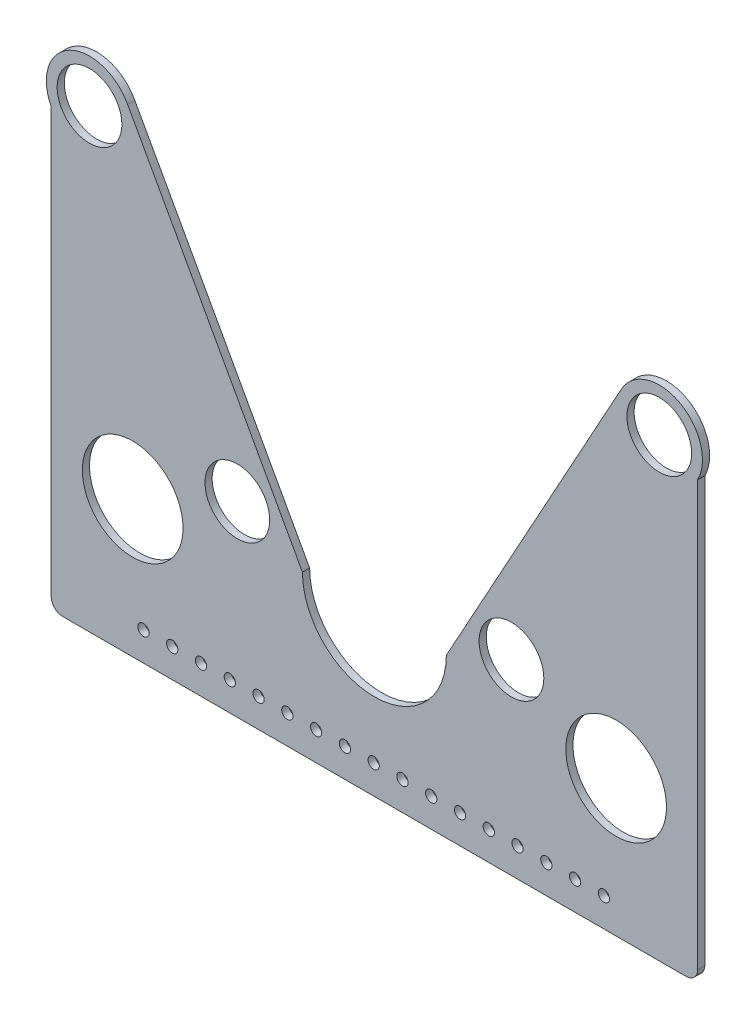
from build123d import *

# Parameters (mm, degrees)
SKETCH2_R           = 2.4892
SKETCH2_R_2         = 14.2875
BOSS_EXTRUDE1_DEPTH = 3.175


with BuildPart() as part:
    # Sketch2 → Boss-Extrude1 (new body)
    with BuildSketch(Plane.XY):
        with BuildLine():
            Line((-142.632381685, 122.462939957), (-142.632381685, -29.937060043))
            Line((-142.632381685, -29.937060043), (-142.632381685, -64.77))
            ThreePointArc((-142.632381685, -64.77), (-141.144484133, -68.362102448), (-137.552381685, -69.85))
            Line((-137.552381685, -69.85), (137.552381685, -69.85))
            ThreePointArc((137.552381685, -69.85), (141.144484133, -68.362102448), (142.632381685, -64.77))
            Line((142.632381685, -64.77), (142.632381685, -29.937060043))
            Line((142.632381685, -29.937060043), (142.632381685, 122.462939957))
            ThreePointArc((142.632381685, 122.462939957), (134.600001748, 148.101160684), (108.918256203, 140.209048469))
            Line((108.918256203, 140.209048469), (31.75, 0))
            ThreePointArc((31.75, 0), (0, -31.75), (-31.75, 0))
            Line((-31.75, 0), (-108.918256203, 140.209048469))
            ThreePointArc((-108.918256203, 140.209048469), (-134.600001748, 148.101160684), (-142.632381685, 122.462939957))
        make_face()
        with Locations((-101.9175, -57.15)):
            Circle(SKETCH2_R, mode=Mode.SUBTRACT)
        with Locations((-89.2175, -57.15)):
            Circle(SKETCH2_R, mode=Mode.SUBTRACT)
        with Locations((-76.5175, -57.15)):
            Circle(SKETCH2_R, mode=Mode.SUBTRACT)
        with Locations((-63.8175, -57.15)):
            Circle(SKETCH2_R, mode=Mode.SUBTRACT)
        with Locations((-51.1175, -57.15)):
            Circle(SKETCH2_R, mode=Mode.SUBTRACT)
        with Locations((-38.4175, -57.15)):
            Circle(SKETCH2_R, mode=Mode.SUBTRACT)
        with Locations((-25.7175, -57.15)):
            Circle(SKETCH2_R, mode=Mode.SUBTRACT)
        with Locations((-13.0175, -57.15)):
            Circle(SKETCH2_R, mode=Mode.SUBTRACT)
        with Locations((-0.3175, -57.15)):
            Circle(SKETCH2_R, mode=Mode.SUBTRACT)
        with BuildLine():
            ThreePointArc((-106.68, -31.75), (-122.395448212, 6.190448212), (-84.455, -9.525))
            ThreePointArc((-84.455, -9.525), (-90.964551788, -25.240448212), (-106.68, -31.75))
        make_face(mode=Mode.SUBTRACT)
        with Locations((-60.484532313, 12.7)):
            Circle(SKETCH2_R_2, mode=Mode.SUBTRACT)
        with Locations((12.3825, -57.15)):
            Circle(SKETCH2_R, mode=Mode.SUBTRACT)
        with Locations((25.0825, -57.15)):
            Circle(SKETCH2_R, mode=Mode.SUBTRACT)
        with Locations((37.7825, -57.15)):
            Circle(SKETCH2_R, mode=Mode.SUBTRACT)
        with Locations((50.4825, -57.15)):
            Circle(SKETCH2_R, mode=Mode.SUBTRACT)
        with Locations((63.1825, -57.15)):
            Circle(SKETCH2_R, mode=Mode.SUBTRACT)
        with Locations((75.8825, -57.15)):
            Circle(SKETCH2_R, mode=Mode.SUBTRACT)
        with Locations((88.5825, -57.15)):
            Circle(SKETCH2_R, mode=Mode.SUBTRACT)
        with Locations((101.2825, -57.15)):
            Circle(SKETCH2_R, mode=Mode.SUBTRACT)
        with Locations((60.484532313, 12.7)):
            Circle(SKETCH2_R_2, mode=Mode.SUBTRACT)
        with BuildLine():
            ThreePointArc((106.68, -31.75), (90.964551788, 6.190448212), (128.905, -9.525))
            ThreePointArc((128.905, -9.525), (122.395448212, -25.240448212), (106.68, -31.75))
        make_face(mode=Mode.SUBTRACT)
        with Locations((-125.726814921, 131.243846084)):
            Circle(SKETCH2_R_2, mode=Mode.SUBTRACT)
        with Locations((125.726814921, 131.243846084)):
            Circle(SKETCH2_R_2, mode=Mode.SUBTRACT)
    extrude(amount=BOSS_EXTRUDE1_DEPTH)


solid = part.part
